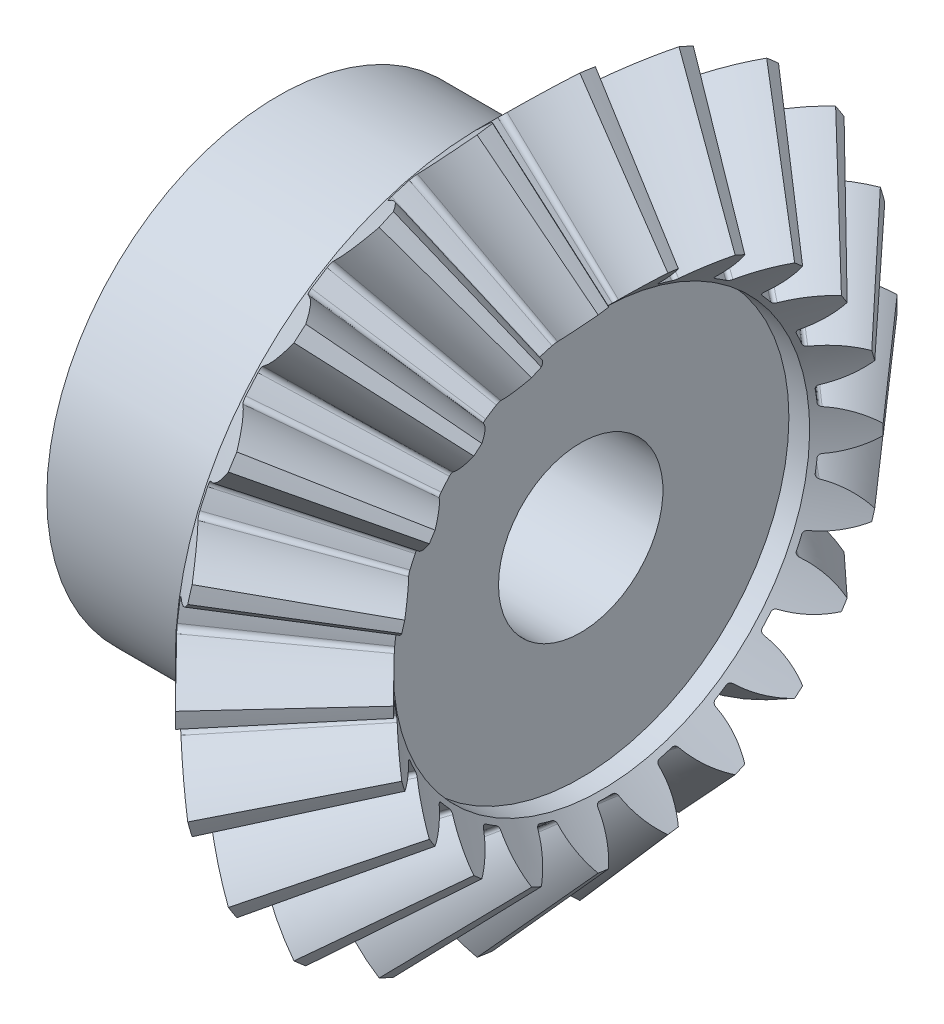
from build123d import *

# Parameters (mm, degrees)
TEETHCUTS_COUNT = 22
TEETHCUTS_ANGLE = 343.636363636
HUBSKE_R        = 22.5
HUB_DEPTH       = 19.849057006
BORSKE_R        = 8
BORE_DEPTH      = 56.0000508


with BuildPart() as part:
    # BasProSke → Base-Revolve (revolve)
    with BuildSketch(Plane(origin=(0, 0, 0), x_dir=(1, 0, 0), z_dir=(0, 1, 0)), mode=Mode.PRIVATE) as base_revolve_sk:
        Polygon((0, 0), (0, 29.848955406), (5.272364937, 35.121320344), (15.197148473, 23.832900444), (11.619385809, 20.255137779), (9.6, 20.255137779), (9.6, 0), align=None)
    revolve(base_revolve_sk.sketch.rotate(Axis((-10, 0, 0), (1, 0, 0)), 180), axis=Axis((-10, 0, 0), (1, 0, 0)))

    # ToothCut: read off the stored shape, not the designer's step
    # ToothCut: loft between two sections, ruled curve by curve
    toothcut_from = [
        Edge.make_bspline([(36.157178055, 0.006133462, -0.009276377), (36.152920253, 0.00187566, -0.014906822), (36.147119928, -0.003924666, -0.014086999), (36.143734285, -0.007310308, -0.007376223)], [0, 0, 0, 0, 1, 1, 1, 1], 3, [1, 0.772587086, 0.772587086, 1]),
        Edge.make_bspline([(36.143734285, -0.007310308, 0.007376223), (36.147119928, -0.003924666, 0.014086999), (36.152920253, 0.00187566, 0.014906822), (36.157178055, 0.006133462, 0.009276377)], [0, 0, 0, 0, 1, 1, 1, 1], 3, [1, 0.772587086, 0.772587086, 1]),
        Edge.make_bspline([(36.143734285, -0.007310308, -0.007376223), (36.143252276, -0.007792318, -0.006420818), (36.142867914, -0.00817668, -0.005380627), (36.142588526, -0.008456067, -0.004275479)], [0, 0, 0, 0, 1, 1, 1, 1], 3, [1, 0.993645628, 0.993645628, 1]),
        Edge.make_bspline([(36.142588526, -0.008456067, 0.004275479), (36.142867914, -0.00817668, 0.005380627), (36.143252276, -0.007792318, 0.006420818), (36.143734285, -0.007310308, 0.007376223)], [0, 0, 0, 0, 1, 1, 1, 1], 3, [1, 0.993645628, 0.993645628, 1]),
        Edge.make_bspline([(36.142588526, -0.008456067, -0.004275479), (36.141882538, -0.009162056, -0.001482864), (36.141882538, -0.009162056, 0.001482864), (36.142588526, -0.008456067, 0.004275479)], [0, 0, 0, 0, 1, 1, 1, 1], 3, [1, 0.961086077, 0.961086077, 1]),
        Edge.make_line((36.157178055, 0.006133462, 0.009276377), (36.157178055, 0.006133462, -0.009276377)),
    ]
    toothcut_to = [
        Edge.make_bspline([(5.561771991, 35.410727397, -4.766810649), (4.264107715, 34.113063121, -3.066384992), (2.684250766, 32.533206173, -1.940589005), (0.945742532, 30.794697938, -1.477457492)], [0, 0, 0, 0, 1, 1, 1, 1], 3, [1, 0.973934056, 0.973934056, 1]),
        Edge.make_bspline([(0.945742532, 30.794697938, 1.477457492), (2.684250766, 32.533206173, 1.940589005), (4.264107715, 34.113063121, 3.066384992), (5.561771991, 35.410727397, 4.766810649)], [0, 0, 0, 0, 1, 1, 1, 1], 3, [1, 0.973934056, 0.973934056, 1]),
        Edge.make_bspline([(0.945742532, 30.794697938, -1.477457492), (0.743163334, 30.592118741, -1.423491219), (0.614035235, 30.462990642, -1.1962449), (0.620372193, 30.4693276, -0.904853913)], [0, 0, 0, 0, 1, 1, 1, 1], 3, [1, 0.839916178, 0.839916178, 1]),
        Edge.make_bspline([(0.620372193, 30.4693276, 0.904853913), (0.614035235, 30.462990642, 1.1962449), (0.743163334, 30.592118741, 1.423491219), (0.945742532, 30.794697938, 1.477457492)], [0, 0, 0, 0, 1, 1, 1, 1], 3, [1, 0.839916178, 0.839916178, 1]),
        Edge.make_bspline([(0.620372193, 30.4693276, -0.904853913), (0.633488861, 30.482444267, -0.301713033), (0.633488861, 30.482444267, 0.301713033), (0.620372193, 30.4693276, 0.904853913)], [0, 0, 0, 0, 1, 1, 1, 1], 3, [1, 0.999684928, 0.999684928, 1]),
        Edge.make_line((5.561771991, 35.410727397, 4.766810649), (5.561771991, 35.410727397, -4.766810649)),
    ]
    toothcut = Solid(Shell([*[Face.make_surface_from_curves(toothcut_from[k], toothcut_to[k]) for k in range(6)], Face(Wire(toothcut_from)), Face(Wire(toothcut_to))]))
    add(toothcut, mode=Mode.SUBTRACT)

    # TeethCuts: ToothCut ×22 about axis
    teethcuts_axis = Axis((-10, 0, 0), (1, 0, 0))
    for i in range(1, TEETHCUTS_COUNT):
        add(toothcut.rotate(teethcuts_axis, i * TEETHCUTS_ANGLE / (TEETHCUTS_COUNT - 1)), mode=Mode.SUBTRACT)

    # HubSke → Hub (add)
    with BuildSketch(Plane.ZY):
        with Locations(Location((0, 0, 0), (0, 0, 180))):
            Circle(HUBSKE_R)
    extrude(amount=HUB_DEPTH)

    # BorSke → Bore (cut, symmetric)
    with BuildSketch(Plane(origin=(0, 0, 0), x_dir=(0, 0, -1), z_dir=(1, 0, 0))):
        with Locations(Location((0, 0, 0), (0, 0, 180))):
            Circle(BORSKE_R)
    extrude(amount=BORE_DEPTH, both=True, mode=Mode.SUBTRACT)


solid = part.part
